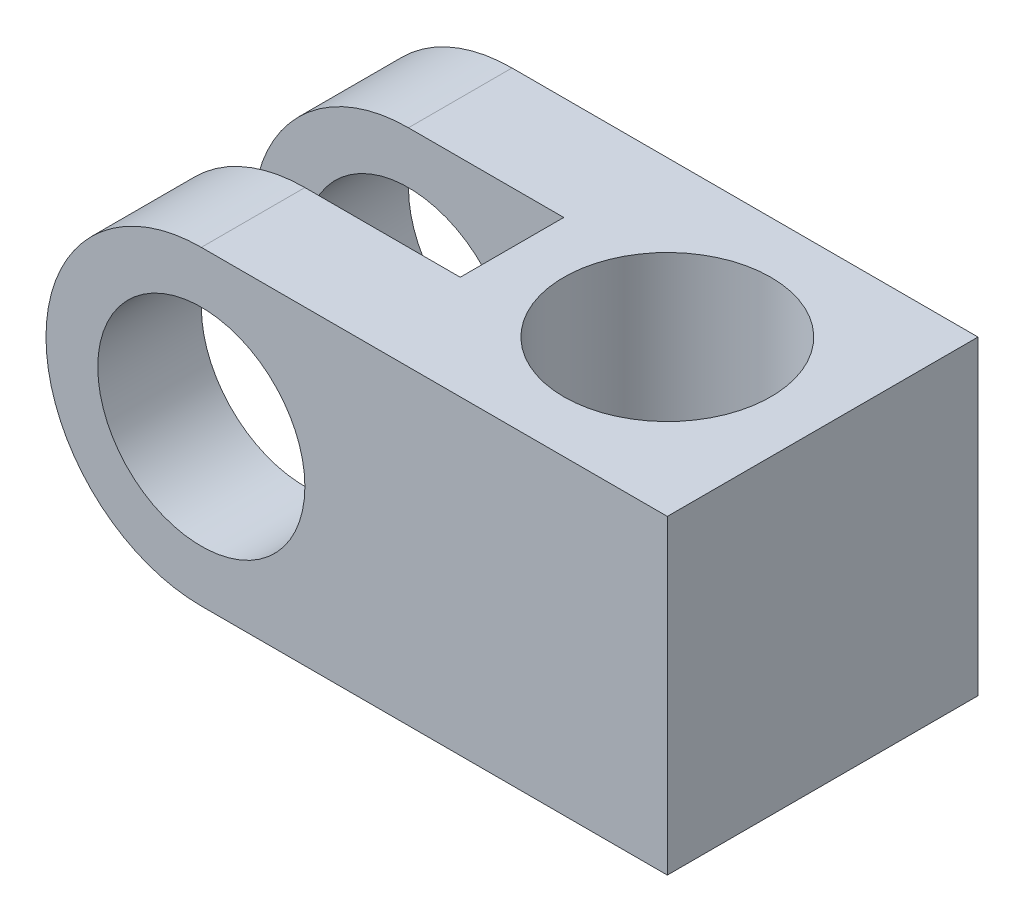
from build123d import *

# Parameters (mm, degrees)
SKETCH1_R           = 10
BOSS_EXTRUDE1_DEPTH = 15
SKETCH2_R           = 10
CUT_EXTRUDE1_DEPTH  = 57.124860802
FILLET1_R           = 15


with BuildPart() as part:
    # Sketch1 → Boss-Extrude1 (new, symmetric)
    with BuildSketch(Plane(origin=(0, 0, 0), x_dir=(1, 0, 0), z_dir=(0, 1, 0))):
        Polygon((-45, 15), (15, 15), (15, -15), (-45, -15), (-45, -5), (-15, -5), (-15, 5), (-45, 5), align=None)
        with Locations(Location((0, 0, 0), (0, 0, 270))):
            Circle(SKETCH1_R, mode=Mode.SUBTRACT)
    extrude(amount=BOSS_EXTRUDE1_DEPTH, both=True)

    # Sketch2 → Cut-Extrude1 (cut, through all)
    with BuildSketch(Plane.XY.offset(15)):
        with Locations((-30, 0)):
            Circle(SKETCH2_R)
    extrude(amount=-CUT_EXTRUDE1_DEPTH, mode=Mode.SUBTRACT)

    # Fillet1
    fillet1_edges = [part.edges().sort_by_distance(p)[0] for p in [
        (-45, -15, -10),
        (-45, 15, -10),
        (-45, -15, 10),
        (-45, 15, 10),
    ]]
    fillet(fillet1_edges, radius=FILLET1_R - 0.0001)  # a hair under: the kernel refuses the full size


solid = part.part
